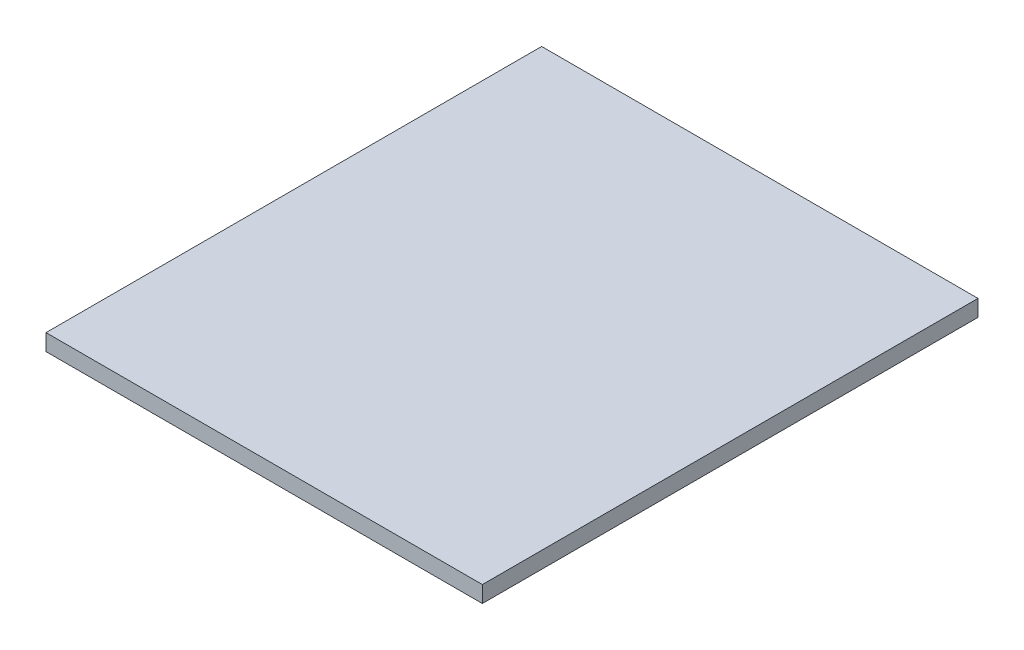
from build123d import *

# Parameters (mm, degrees)
SKETCH1_W           = 26.5
SKETCH1_H           = 30.1
BOSS_EXTRUDE1_DEPTH = 1


with BuildPart() as part:
    # Sketch1 → Boss-Extrude1 (new body)
    with BuildSketch(Plane(origin=(0, 0, 0), x_dir=(1, 0, 0), z_dir=(0, 1, 0))):
        with Locations((13.25, 15.05)):
            Rectangle(SKETCH1_W, SKETCH1_H)
    extrude(amount=BOSS_EXTRUDE1_DEPTH)


solid = part.part
